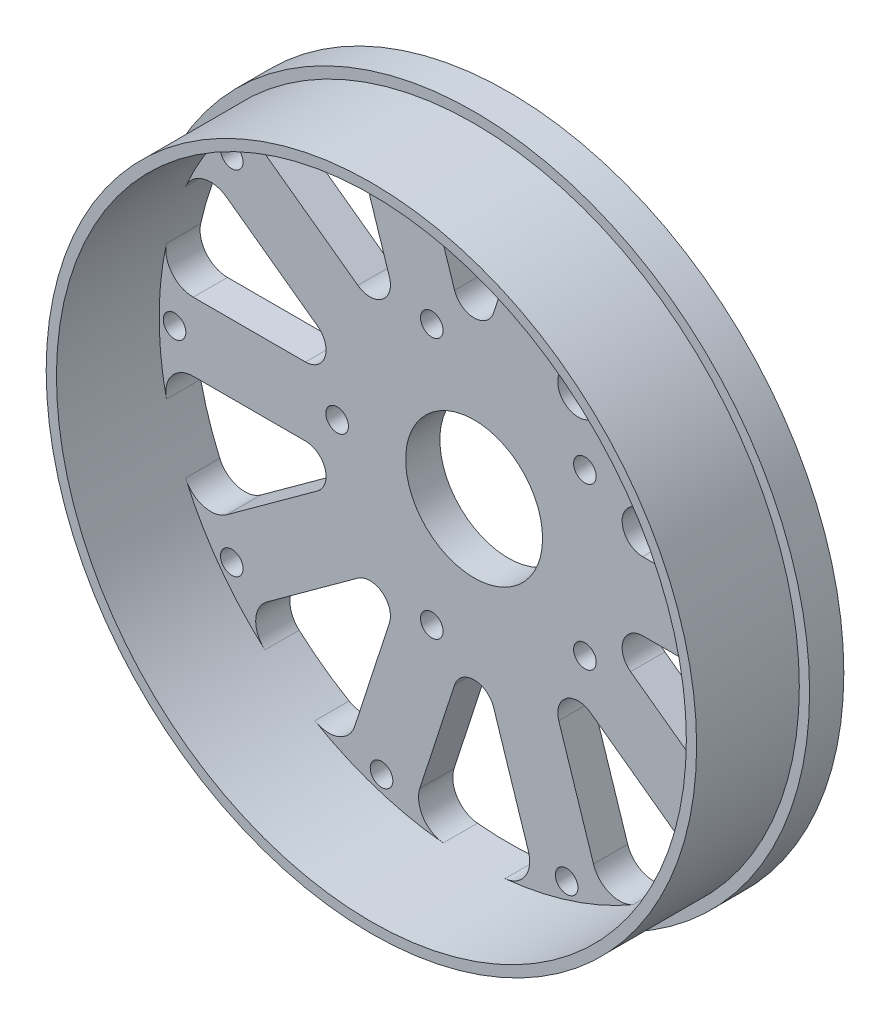
from build123d import *

# Parameters (mm, degrees)
BOSS_EXTRUDE3_DEPTH   = 15
BOSS_EXTRUDE4_START   = -5
SKETCH1_6_R           = 10
BOSS_EXTRUDE4_DEPTH   = 5
FILLET1_R             = 4
FILLET2_R             = 3
M4X0_7_TAPPED_HOLE1_D = 3.3
CIRPATTERN1_COUNT     = 5
M4X0_7_TAPPED_HOLE2_D = 3.3
CIRPATTERN2_COUNT     = 10


with BuildPart() as part:
    # Sketch1 → Boss-Extrude3 (new body)
    with BuildSketch(Plane.XY):
        with BuildLine():
            ThreePointArc((-45.727453461, 5), (-43.74859975, 14.214781741), (-39.933213221, 22.832837797))
            Line((-39.933213221, 22.832837797), (-41.153741247, 23.719603315))
            ThreePointArc((-41.153741247, 23.719603315), (-45.175184524, 14.678307233), (-47.236109069, 5))
            Line((-47.236109069, 5), (-45.727453461, 5))
        make_face()
        with BuildLine():
            ThreePointArc((-39.933213221, 22.832837797), (-37.214781741, 27.038121605), (-34.055360698, 30.923007741))
            Line((-34.055360698, 30.923007741), (-35.275888724, 31.809773258))
            ThreePointArc((-35.275888724, 31.809773258), (-38.428307233, 27.919799484), (-41.153741247, 23.719603315))
            Line((-41.153741247, 23.719603315), (-39.933213221, 22.832837797))
        make_face()
        with BuildLine():
            ThreePointArc((-34.055360698, 30.923007741), (-27.038121605, 37.214781741), (-18.88584281, 41.944307616))
            Line((-18.88584281, 41.944307616), (-19.352043032, 43.379124363))
            ThreePointArc((-19.352043032, 43.379124363), (-27.919799484, 38.428307233), (-35.275888724, 31.809773258))
            Line((-35.275888724, 31.809773258), (-34.055360698, 30.923007741))
        make_face()
        with BuildLine():
            ThreePointArc((-45.727453461, -5), (-46, 0), (-45.727453461, 5))
            Line((-45.727453461, 5), (-47.236109069, 5))
            ThreePointArc((-47.236109069, 5), (-47.5, 0), (-47.236109069, -5))
            Line((-47.236109069, -5), (-45.727453461, -5))
        make_face()
        with BuildLine():
            ThreePointArc((-39.933213221, -22.832837797), (-43.74859975, -14.214781741), (-45.727453461, -5))
            Line((-45.727453461, -5), (-47.236109069, -5))
            ThreePointArc((-47.236109069, -5), (-45.175184524, -14.678307233), (-41.153741247, -23.719603315))
            Line((-41.153741247, -23.719603315), (-39.933213221, -22.832837797))
        make_face()
        with BuildLine():
            Line((-35.275888724, -31.809773258), (-34.055360698, -30.923007741))
            ThreePointArc((-34.055360698, -30.923007741), (-37.214781741, -27.038121605), (-39.933213221, -22.832837797))
            Line((-39.933213221, -22.832837797), (-41.153741247, -23.719603315))
            ThreePointArc((-41.153741247, -23.719603315), (-38.428307233, -27.919799484), (-35.275888724, -31.809773258))
        make_face()
        with BuildLine():
            ThreePointArc((-18.88584281, 41.944307616), (-14.214781741, 43.74859975), (-9.375277647, 45.034477559))
            Line((-9.375277647, 45.034477559), (-9.841477869, 46.469294307))
            ThreePointArc((-9.841477869, 46.469294307), (-14.678307233, 45.175184524), (-19.352043032, 43.379124363))
            Line((-19.352043032, 43.379124363), (-18.88584281, 41.944307616))
        make_face()
        with BuildLine():
            ThreePointArc((-9.375277647, 45.034477559), (0, 46), (9.375277647, 45.034477559))
            Line((9.375277647, 45.034477559), (9.841477869, 46.469294307))
            ThreePointArc((9.841477869, 46.469294307), (0, 47.5), (-9.841477869, 46.469294307))
            Line((-9.841477869, 46.469294307), (-9.375277647, 45.034477559))
        make_face()
        with BuildLine():
            ThreePointArc((9.375277647, 45.034477559), (14.214781741, 43.74859975), (18.88584281, 41.944307616))
            Line((18.88584281, 41.944307616), (19.352043032, 43.379124363))
            ThreePointArc((19.352043032, 43.379124363), (14.678307233, 45.175184524), (9.841477869, 46.469294307))
            Line((9.841477869, 46.469294307), (9.375277647, 45.034477559))
        make_face()
        with BuildLine():
            ThreePointArc((18.88584281, 41.944307616), (27.038121605, 37.214781741), (34.055360698, 30.923007741))
            Line((34.055360698, 30.923007741), (35.275888724, 31.809773258))
            ThreePointArc((35.275888724, 31.809773258), (27.919799484, 38.428307233), (19.352043032, 43.379124363))
            Line((19.352043032, 43.379124363), (18.88584281, 41.944307616))
        make_face()
        with BuildLine():
            ThreePointArc((34.055360698, 30.923007741), (37.214781741, 27.038121605), (39.933213221, 22.832837797))
            Line((39.933213221, 22.832837797), (41.153741247, 23.719603315))
            ThreePointArc((41.153741247, 23.719603315), (38.428307233, 27.919799484), (35.275888724, 31.809773258))
            Line((35.275888724, 31.809773258), (34.055360698, 30.923007741))
        make_face()
        with BuildLine():
            ThreePointArc((39.933213221, 22.832837797), (43.74859975, 14.214781741), (45.727453461, 5))
            Line((45.727453461, 5), (47.236109069, 5))
            ThreePointArc((47.236109069, 5), (45.175184524, 14.678307233), (41.153741247, 23.719603315))
            Line((41.153741247, 23.719603315), (39.933213221, 22.832837797))
        make_face()
        with BuildLine():
            Line((47.236109069, 5), (45.727453461, 5))
            ThreePointArc((45.727453461, 5), (45.931812827, 2.503711326), (46, 0))
            ThreePointArc((46, 0), (45.931812827, -2.503711326), (45.727453461, -5))
            Line((45.727453461, -5), (47.236109069, -5))
            ThreePointArc((47.236109069, -5), (47.433981389, -2.5034795), (47.5, 0))
            ThreePointArc((47.5, 0), (47.433981389, 2.5034795), (47.236109069, 5))
        make_face()
        with BuildLine():
            Line((47.236109069, -5), (45.727453461, -5))
            ThreePointArc((45.727453461, -5), (43.74859975, -14.214781741), (39.933213221, -22.832837797))
            Line((39.933213221, -22.832837797), (41.153741247, -23.719603315))
            ThreePointArc((41.153741247, -23.719603315), (45.175184524, -14.678307233), (47.236109069, -5))
        make_face()
        with BuildLine():
            Line((41.153741247, -23.719603315), (39.933213221, -22.832837797))
            ThreePointArc((39.933213221, -22.832837797), (37.214781741, -27.038121605), (34.055360698, -30.923007741))
            Line((34.055360698, -30.923007741), (35.275888724, -31.809773258))
            ThreePointArc((35.275888724, -31.809773258), (38.428307233, -27.919799484), (41.153741247, -23.719603315))
        make_face()
        with BuildLine():
            Line((35.275888724, -31.809773258), (34.055360698, -30.923007741))
            ThreePointArc((34.055360698, -30.923007741), (27.038121605, -37.214781741), (18.88584281, -41.944307616))
            Line((18.88584281, -41.944307616), (19.352043032, -43.379124363))
            ThreePointArc((19.352043032, -43.379124363), (27.919799484, -38.428307233), (35.275888724, -31.809773258))
        make_face()
        with BuildLine():
            Line((19.352043032, -43.379124363), (18.88584281, -41.944307616))
            ThreePointArc((18.88584281, -41.944307616), (14.214781741, -43.74859975), (9.375277647, -45.034477559))
            Line((9.375277647, -45.034477559), (9.841477869, -46.469294307))
            ThreePointArc((9.841477869, -46.469294307), (14.678307233, -45.175184524), (19.352043032, -43.379124363))
        make_face()
        with BuildLine():
            Line((9.841477869, -46.469294307), (9.375277647, -45.034477559))
            ThreePointArc((9.375277647, -45.034477559), (0, -46), (-9.375277647, -45.034477559))
            Line((-9.375277647, -45.034477559), (-9.841477869, -46.469294307))
            ThreePointArc((-9.841477869, -46.469294307), (0, -47.5), (9.841477869, -46.469294307))
        make_face()
        with BuildLine():
            Line((-9.841477869, -46.469294307), (-9.375277647, -45.034477559))
            ThreePointArc((-9.375277647, -45.034477559), (-14.214781741, -43.74859975), (-18.88584281, -41.944307616))
            Line((-18.88584281, -41.944307616), (-19.352043032, -43.379124363))
            ThreePointArc((-19.352043032, -43.379124363), (-14.678307233, -45.175184524), (-9.841477869, -46.469294307))
        make_face()
        with BuildLine():
            Line((-19.352043032, -43.379124363), (-18.88584281, -41.944307616))
            ThreePointArc((-18.88584281, -41.944307616), (-27.038121605, -37.214781741), (-34.055360698, -30.923007741))
            Line((-34.055360698, -30.923007741), (-35.275888724, -31.809773258))
            ThreePointArc((-35.275888724, -31.809773258), (-27.919799484, -38.428307233), (-19.352043032, -43.379124363))
        make_face()
    extrude(amount=BOSS_EXTRUDE3_DEPTH)

    # Sketch1<6> → Boss-Extrude4 (add)
    # profile 1 of 41: a face of its own
    with BuildSketch(Plane.XY.offset(BOSS_EXTRUDE4_START)):
        with BuildLine():
            ThreePointArc((-19.352043032, 43.379124363), (-14.678307233, 45.175184524), (-9.841477869, 46.469294307))
            Line((-9.841477869, 46.469294307), (-10.307512998, 47.903602952))
            ThreePointArc((-10.307512998, 47.903602952), (-15.141832724, 46.601769298), (-19.818078161, 44.813433008))
            Line((-19.818078161, 44.813433008), (-19.352043032, 43.379124363))
        make_face()
    # profile 2 of 41: a face of its own
    with BuildSketch(Plane.XY.offset(BOSS_EXTRUDE4_START)):
        with BuildLine():
            ThreePointArc((-9.841477869, 46.469294307), (0, 47.5), (9.841477869, 46.469294307))
            Line((9.841477869, 46.469294307), (10.307512998, 47.903602952))
            ThreePointArc((10.307512998, 47.903602952), (0, 49), (-10.307512998, 47.903602952))
            Line((-10.307512998, 47.903602952), (-9.841477869, 46.469294307))
        make_face()
    # profile 3 of 41: a face of its own
    with BuildSketch(Plane.XY.offset(BOSS_EXTRUDE4_START)):
        with BuildLine():
            ThreePointArc((9.841477869, 46.469294307), (14.678307233, 45.175184524), (19.352043032, 43.379124363))
            Line((19.352043032, 43.379124363), (19.818078161, 44.813433008))
            ThreePointArc((19.818078161, 44.813433008), (15.141832724, 46.601769298), (10.307512998, 47.903602952))
            Line((10.307512998, 47.903602952), (9.841477869, 46.469294307))
        make_face()
    # profile 4 of 41: a face of its own
    with BuildSketch(Plane.XY.offset(BOSS_EXTRUDE4_START)):
        with BuildLine():
            ThreePointArc((19.352043032, 43.379124363), (27.919799484, 38.428307233), (35.275888724, 31.809773258))
            Line((35.275888724, 31.809773258), (36.495984532, 32.696224752))
            ThreePointArc((36.495984532, 32.696224752), (28.801477362, 39.641832724), (19.818078161, 44.813433008))
            Line((19.818078161, 44.813433008), (19.352043032, 43.379124363))
        make_face()
    # profile 5 of 41: a face of its own
    with BuildSketch(Plane.XY.offset(BOSS_EXTRUDE4_START)):
        with BuildLine():
            ThreePointArc((35.275888724, 31.809773258), (38.428307233, 27.919799484), (41.153741247, 23.719603315))
            Line((41.153741247, 23.719603315), (42.373837055, 24.606054808))
            ThreePointArc((42.373837055, 24.606054808), (39.641832724, 28.801477362), (36.495984532, 32.696224752))
            Line((36.495984532, 32.696224752), (35.275888724, 31.809773258))
        make_face()
    # profile 6 of 41: a face of its own
    with BuildSketch(Plane.XY.offset(BOSS_EXTRUDE4_START)):
        with BuildLine():
            ThreePointArc((41.153741247, 23.719603315), (45.175184524, 14.678307233), (47.236109069, 5))
            Line((47.236109069, 5), (48.744230428, 5))
            ThreePointArc((48.744230428, 5), (46.601769298, 15.141832724), (42.373837055, 24.606054808))
            Line((42.373837055, 24.606054808), (41.153741247, 23.719603315))
        make_face()
    # profile 7 of 41: a face of its own
    with BuildSketch(Plane.XY.offset(BOSS_EXTRUDE4_START)):
        with BuildLine():
            Line((48.744230428, 5), (47.236109069, 5))
            ThreePointArc((47.236109069, 5), (47.433981389, 2.5034795), (47.5, 0))
            ThreePointArc((47.5, 0), (47.433981389, -2.5034795), (47.236109069, -5))
            Line((47.236109069, -5), (48.744230428, -5))
            ThreePointArc((48.744230428, -5), (48.936015832, -2.503268767), (49, 0))
            ThreePointArc((49, 0), (48.936015832, 2.503268767), (48.744230428, 5))
        make_face()
    # profile 8 of 41: a face of its own
    with BuildSketch(Plane.XY.offset(BOSS_EXTRUDE4_START)):
        with BuildLine():
            Line((48.744230428, -5), (47.236109069, -5))
            ThreePointArc((47.236109069, -5), (45.175184524, -14.678307233), (41.153741247, -23.719603315))
            Line((41.153741247, -23.719603315), (42.373837055, -24.606054808))
            ThreePointArc((42.373837055, -24.606054808), (46.601769298, -15.141832724), (48.744230428, -5))
        make_face()
    # profile 9 of 41: a face of its own
    with BuildSketch(Plane.XY.offset(BOSS_EXTRUDE4_START)):
        with BuildLine():
            Line((42.373837055, -24.606054808), (41.153741247, -23.719603315))
            ThreePointArc((41.153741247, -23.719603315), (38.428307233, -27.919799484), (35.275888724, -31.809773258))
            Line((35.275888724, -31.809773258), (36.495984532, -32.696224752))
            ThreePointArc((36.495984532, -32.696224752), (39.641832724, -28.801477362), (42.373837055, -24.606054808))
        make_face()
    # profile 10 of 41: a face of its own
    with BuildSketch(Plane.XY.offset(BOSS_EXTRUDE4_START)):
        with BuildLine():
            Line((36.495984532, -32.696224752), (35.275888724, -31.809773258))
            ThreePointArc((35.275888724, -31.809773258), (27.919799484, -38.428307233), (19.352043032, -43.379124363))
            Line((19.352043032, -43.379124363), (19.818078161, -44.813433008))
            ThreePointArc((19.818078161, -44.813433008), (28.801477362, -39.641832724), (36.495984532, -32.696224752))
        make_face()
    # profile 11 of 41: a face of its own
    with BuildSketch(Plane.XY.offset(BOSS_EXTRUDE4_START)):
        with BuildLine():
            Line((19.818078161, -44.813433008), (19.352043032, -43.379124363))
            ThreePointArc((19.352043032, -43.379124363), (14.678307233, -45.175184524), (9.841477869, -46.469294307))
            Line((9.841477869, -46.469294307), (10.307512998, -47.903602952))
            ThreePointArc((10.307512998, -47.903602952), (15.141832724, -46.601769298), (19.818078161, -44.813433008))
        make_face()
    # profile 12 of 41: a face of its own
    with BuildSketch(Plane.XY.offset(BOSS_EXTRUDE4_START)):
        with BuildLine():
            Line((10.307512998, -47.903602952), (9.841477869, -46.469294307))
            ThreePointArc((9.841477869, -46.469294307), (0, -47.5), (-9.841477869, -46.469294307))
            Line((-9.841477869, -46.469294307), (-10.307512998, -47.903602952))
            ThreePointArc((-10.307512998, -47.903602952), (0, -49), (10.307512998, -47.903602952))
        make_face()
    # profile 13 of 41: a face of its own
    with BuildSketch(Plane.XY.offset(BOSS_EXTRUDE4_START)):
        with BuildLine():
            Line((-10.307512998, -47.903602952), (-9.841477869, -46.469294307))
            ThreePointArc((-9.841477869, -46.469294307), (-14.678307233, -45.175184524), (-19.352043032, -43.379124363))
            Line((-19.352043032, -43.379124363), (-19.818078161, -44.813433008))
            ThreePointArc((-19.818078161, -44.813433008), (-15.141832724, -46.601769298), (-10.307512998, -47.903602952))
        make_face()
    # profile 14 of 41: a face of its own
    with BuildSketch(Plane.XY.offset(BOSS_EXTRUDE4_START)):
        with BuildLine():
            Line((-19.818078161, -44.813433008), (-19.352043032, -43.379124363))
            ThreePointArc((-19.352043032, -43.379124363), (-27.919799484, -38.428307233), (-35.275888724, -31.809773258))
            Line((-35.275888724, -31.809773258), (-36.495984532, -32.696224752))
            ThreePointArc((-36.495984532, -32.696224752), (-28.801477362, -39.641832724), (-19.818078161, -44.813433008))
        make_face()
    # profile 15 of 41: a face of its own
    with BuildSketch(Plane.XY.offset(BOSS_EXTRUDE4_START)):
        with BuildLine():
            Line((-36.495984532, -32.696224752), (-35.275888724, -31.809773258))
            ThreePointArc((-35.275888724, -31.809773258), (-38.428307233, -27.919799484), (-41.153741247, -23.719603315))
            Line((-41.153741247, -23.719603315), (-42.373837055, -24.606054808))
            ThreePointArc((-42.373837055, -24.606054808), (-39.641832724, -28.801477362), (-36.495984532, -32.696224752))
        make_face()
    # profile 16 of 41: a face of its own
    with BuildSketch(Plane.XY.offset(BOSS_EXTRUDE4_START)):
        with BuildLine():
            ThreePointArc((-41.153741247, -23.719603315), (-45.175184524, -14.678307233), (-47.236109069, -5))
            Line((-47.236109069, -5), (-48.744230428, -5))
            ThreePointArc((-48.744230428, -5), (-46.601769298, -15.141832724), (-42.373837055, -24.606054808))
            Line((-42.373837055, -24.606054808), (-41.153741247, -23.719603315))
        make_face()
    # profile 17 of 41: a face of its own
    with BuildSketch(Plane.XY.offset(BOSS_EXTRUDE4_START)):
        with BuildLine():
            ThreePointArc((-47.236109069, -5), (-47.5, 0), (-47.236109069, 5))
            Line((-47.236109069, 5), (-48.744230428, 5))
            ThreePointArc((-48.744230428, 5), (-49, 0), (-48.744230428, -5))
            Line((-48.744230428, -5), (-47.236109069, -5))
        make_face()
    # profile 18 of 41: a face of its own
    with BuildSketch(Plane.XY.offset(BOSS_EXTRUDE4_START)):
        with BuildLine():
            ThreePointArc((-47.236109069, 5), (-45.175184524, 14.678307233), (-41.153741247, 23.719603315))
            Line((-41.153741247, 23.719603315), (-42.373837055, 24.606054808))
            ThreePointArc((-42.373837055, 24.606054808), (-46.601769298, 15.141832724), (-48.744230428, 5))
            Line((-48.744230428, 5), (-47.236109069, 5))
        make_face()
    # profile 19 of 41: a face of its own
    with BuildSketch(Plane.XY.offset(BOSS_EXTRUDE4_START)):
        with BuildLine():
            ThreePointArc((-41.153741247, 23.719603315), (-38.428307233, 27.919799484), (-35.275888724, 31.809773258))
            Line((-35.275888724, 31.809773258), (-36.495984532, 32.696224752))
            ThreePointArc((-36.495984532, 32.696224752), (-39.641832724, 28.801477362), (-42.373837055, 24.606054808))
            Line((-42.373837055, 24.606054808), (-41.153741247, 23.719603315))
        make_face()
    # profile 20 of 41: a face of its own
    with BuildSketch(Plane.XY.offset(BOSS_EXTRUDE4_START)):
        with BuildLine():
            ThreePointArc((-35.275888724, 31.809773258), (-27.919799484, 38.428307233), (-19.352043032, 43.379124363))
            Line((-19.352043032, 43.379124363), (-19.818078161, 44.813433008))
            ThreePointArc((-19.818078161, 44.813433008), (-28.801477362, 39.641832724), (-36.495984532, 32.696224752))
            Line((-36.495984532, 32.696224752), (-35.275888724, 31.809773258))
        make_face()
    # profile 21 of 41: a face of its own
    with BuildSketch(Plane.XY.offset(BOSS_EXTRUDE4_START)):
        with BuildLine():
            ThreePointArc((9.375277647, 45.034477559), (14.214781741, 43.74859975), (18.88584281, 41.944307616))
            Line((18.88584281, 41.944307616), (19.352043032, 43.379124363))
            ThreePointArc((19.352043032, 43.379124363), (14.678307233, 45.175184524), (9.841477869, 46.469294307))
            Line((9.841477869, 46.469294307), (9.375277647, 45.034477559))
        make_face()
    # profile 22 of 41: a face of its own
    with BuildSketch(Plane.XY.offset(BOSS_EXTRUDE4_START)):
        with BuildLine():
            ThreePointArc((18.88584281, 41.944307616), (27.038121605, 37.214781741), (34.055360698, 30.923007741))
            Line((34.055360698, 30.923007741), (35.275888724, 31.809773258))
            ThreePointArc((35.275888724, 31.809773258), (27.919799484, 38.428307233), (19.352043032, 43.379124363))
            Line((19.352043032, 43.379124363), (18.88584281, 41.944307616))
        make_face()
    # profile 23 of 41: a face of its own
    with BuildSketch(Plane.XY.offset(BOSS_EXTRUDE4_START)):
        with BuildLine():
            ThreePointArc((34.055360698, 30.923007741), (37.214781741, 27.038121605), (39.933213221, 22.832837797))
            Line((39.933213221, 22.832837797), (41.153741247, 23.719603315))
            ThreePointArc((41.153741247, 23.719603315), (38.428307233, 27.919799484), (35.275888724, 31.809773258))
            Line((35.275888724, 31.809773258), (34.055360698, 30.923007741))
        make_face()
    # profile 24 of 41: a face of its own
    with BuildSketch(Plane.XY.offset(BOSS_EXTRUDE4_START)):
        with BuildLine():
            ThreePointArc((39.933213221, 22.832837797), (43.74859975, 14.214781741), (45.727453461, 5))
            Line((45.727453461, 5), (47.236109069, 5))
            ThreePointArc((47.236109069, 5), (45.175184524, 14.678307233), (41.153741247, 23.719603315))
            Line((41.153741247, 23.719603315), (39.933213221, 22.832837797))
        make_face()
    # profile 25 of 41: a face of its own
    with BuildSketch(Plane.XY.offset(BOSS_EXTRUDE4_START)):
        with BuildLine():
            Line((47.236109069, 5), (45.727453461, 5))
            ThreePointArc((45.727453461, 5), (45.931812827, 2.503711326), (46, 0))
            ThreePointArc((46, 0), (45.931812827, -2.503711326), (45.727453461, -5))
            Line((45.727453461, -5), (47.236109069, -5))
            ThreePointArc((47.236109069, -5), (47.433981389, -2.5034795), (47.5, 0))
            ThreePointArc((47.5, 0), (47.433981389, 2.5034795), (47.236109069, 5))
        make_face()
    # profile 26 of 41: a face of its own
    with BuildSketch(Plane.XY.offset(BOSS_EXTRUDE4_START)):
        with BuildLine():
            Line((47.236109069, -5), (45.727453461, -5))
            ThreePointArc((45.727453461, -5), (43.74859975, -14.214781741), (39.933213221, -22.832837797))
            Line((39.933213221, -22.832837797), (41.153741247, -23.719603315))
            ThreePointArc((41.153741247, -23.719603315), (45.175184524, -14.678307233), (47.236109069, -5))
        make_face()
    # profile 27 of 41: a face of its own
    with BuildSketch(Plane.XY.offset(BOSS_EXTRUDE4_START)):
        with BuildLine():
            Line((41.153741247, -23.719603315), (39.933213221, -22.832837797))
            ThreePointArc((39.933213221, -22.832837797), (37.214781741, -27.038121605), (34.055360698, -30.923007741))
            Line((34.055360698, -30.923007741), (35.275888724, -31.809773258))
            ThreePointArc((35.275888724, -31.809773258), (38.428307233, -27.919799484), (41.153741247, -23.719603315))
        make_face()
    # profile 28 of 41: a face of its own
    with BuildSketch(Plane.XY.offset(BOSS_EXTRUDE4_START)):
        with BuildLine():
            Line((35.275888724, -31.809773258), (34.055360698, -30.923007741))
            ThreePointArc((34.055360698, -30.923007741), (27.038121605, -37.214781741), (18.88584281, -41.944307616))
            Line((18.88584281, -41.944307616), (19.352043032, -43.379124363))
            ThreePointArc((19.352043032, -43.379124363), (27.919799484, -38.428307233), (35.275888724, -31.809773258))
        make_face()
    # profile 29 of 41: a face of its own
    with BuildSketch(Plane.XY.offset(BOSS_EXTRUDE4_START)):
        with BuildLine():
            Line((19.352043032, -43.379124363), (18.88584281, -41.944307616))
            ThreePointArc((18.88584281, -41.944307616), (14.214781741, -43.74859975), (9.375277647, -45.034477559))
            Line((9.375277647, -45.034477559), (9.841477869, -46.469294307))
            ThreePointArc((9.841477869, -46.469294307), (14.678307233, -45.175184524), (19.352043032, -43.379124363))
        make_face()
    # profile 30 of 41: a face of its own
    with BuildSketch(Plane.XY.offset(BOSS_EXTRUDE4_START)):
        with BuildLine():
            Line((9.841477869, -46.469294307), (9.375277647, -45.034477559))
            ThreePointArc((9.375277647, -45.034477559), (0, -46), (-9.375277647, -45.034477559))
            Line((-9.375277647, -45.034477559), (-9.841477869, -46.469294307))
            ThreePointArc((-9.841477869, -46.469294307), (0, -47.5), (9.841477869, -46.469294307))
        make_face()
    # profile 31 of 41: a face of its own
    with BuildSketch(Plane.XY.offset(BOSS_EXTRUDE4_START)):
        with BuildLine():
            Line((-9.841477869, -46.469294307), (-9.375277647, -45.034477559))
            ThreePointArc((-9.375277647, -45.034477559), (-14.214781741, -43.74859975), (-18.88584281, -41.944307616))
            Line((-18.88584281, -41.944307616), (-19.352043032, -43.379124363))
            ThreePointArc((-19.352043032, -43.379124363), (-14.678307233, -45.175184524), (-9.841477869, -46.469294307))
        make_face()
    # profile 32 of 41: a face of its own
    with BuildSketch(Plane.XY.offset(BOSS_EXTRUDE4_START)):
        with BuildLine():
            Line((-19.352043032, -43.379124363), (-18.88584281, -41.944307616))
            ThreePointArc((-18.88584281, -41.944307616), (-27.038121605, -37.214781741), (-34.055360698, -30.923007741))
            Line((-34.055360698, -30.923007741), (-35.275888724, -31.809773258))
            ThreePointArc((-35.275888724, -31.809773258), (-27.919799484, -38.428307233), (-19.352043032, -43.379124363))
        make_face()
    # profile 33 of 41: a face of its own
    with BuildSketch(Plane.XY.offset(BOSS_EXTRUDE4_START)):
        with BuildLine():
            Line((-35.275888724, -31.809773258), (-34.055360698, -30.923007741))
            ThreePointArc((-34.055360698, -30.923007741), (-37.214781741, -27.038121605), (-39.933213221, -22.832837797))
            Line((-39.933213221, -22.832837797), (-41.153741247, -23.719603315))
            ThreePointArc((-41.153741247, -23.719603315), (-38.428307233, -27.919799484), (-35.275888724, -31.809773258))
        make_face()
    # profile 34 of 41: a face of its own
    with BuildSketch(Plane.XY.offset(BOSS_EXTRUDE4_START)):
        with BuildLine():
            ThreePointArc((-39.933213221, -22.832837797), (-43.74859975, -14.214781741), (-45.727453461, -5))
            Line((-45.727453461, -5), (-47.236109069, -5))
            ThreePointArc((-47.236109069, -5), (-45.175184524, -14.678307233), (-41.153741247, -23.719603315))
            Line((-41.153741247, -23.719603315), (-39.933213221, -22.832837797))
        make_face()
    # profile 35 of 41: a face of its own
    with BuildSketch(Plane.XY.offset(BOSS_EXTRUDE4_START)):
        with BuildLine():
            ThreePointArc((-45.727453461, -5), (-46, 0), (-45.727453461, 5))
            Line((-45.727453461, 5), (-47.236109069, 5))
            ThreePointArc((-47.236109069, 5), (-47.5, 0), (-47.236109069, -5))
            Line((-47.236109069, -5), (-45.727453461, -5))
        make_face()
    # profile 36 of 41: a face of its own
    with BuildSketch(Plane.XY.offset(BOSS_EXTRUDE4_START)):
        with BuildLine():
            ThreePointArc((-45.727453461, 5), (-43.74859975, 14.214781741), (-39.933213221, 22.832837797))
            Line((-39.933213221, 22.832837797), (-41.153741247, 23.719603315))
            ThreePointArc((-41.153741247, 23.719603315), (-45.175184524, 14.678307233), (-47.236109069, 5))
            Line((-47.236109069, 5), (-45.727453461, 5))
        make_face()
    # profile 37 of 41: a face of its own
    with BuildSketch(Plane.XY.offset(BOSS_EXTRUDE4_START)):
        with BuildLine():
            ThreePointArc((-39.933213221, 22.832837797), (-37.214781741, 27.038121605), (-34.055360698, 30.923007741))
            Line((-34.055360698, 30.923007741), (-35.275888724, 31.809773258))
            ThreePointArc((-35.275888724, 31.809773258), (-38.428307233, 27.919799484), (-41.153741247, 23.719603315))
            Line((-41.153741247, 23.719603315), (-39.933213221, 22.832837797))
        make_face()
    # profile 38 of 41: a face of its own
    with BuildSketch(Plane.XY.offset(BOSS_EXTRUDE4_START)):
        with BuildLine():
            ThreePointArc((-34.055360698, 30.923007741), (-27.038121605, 37.214781741), (-18.88584281, 41.944307616))
            Line((-18.88584281, 41.944307616), (-19.352043032, 43.379124363))
            ThreePointArc((-19.352043032, 43.379124363), (-27.919799484, 38.428307233), (-35.275888724, 31.809773258))
            Line((-35.275888724, 31.809773258), (-34.055360698, 30.923007741))
        make_face()
    # profile 39 of 41: a face of its own
    with BuildSketch(Plane.XY.offset(BOSS_EXTRUDE4_START)):
        with BuildLine():
            ThreePointArc((-18.88584281, 41.944307616), (-14.214781741, 43.74859975), (-9.375277647, 45.034477559))
            Line((-9.375277647, 45.034477559), (-9.841477869, 46.469294307))
            ThreePointArc((-9.841477869, 46.469294307), (-14.678307233, 45.175184524), (-19.352043032, 43.379124363))
            Line((-19.352043032, 43.379124363), (-18.88584281, 41.944307616))
        make_face()
    # profile 40 of 41: a face of its own
    with BuildSketch(Plane.XY.offset(BOSS_EXTRUDE4_START)):
        with BuildLine():
            ThreePointArc((-9.375277647, 45.034477559), (0, 46), (9.375277647, 45.034477559))
            Line((9.375277647, 45.034477559), (9.841477869, 46.469294307))
            ThreePointArc((9.841477869, 46.469294307), (0, 47.5), (-9.841477869, 46.469294307))
            Line((-9.841477869, 46.469294307), (-9.375277647, 45.034477559))
        make_face()
    # profile 41 of 41: a face of its own
    with BuildSketch(Plane.XY.offset(BOSS_EXTRUDE4_START)):
        with BuildLine():
            Line((45.727453461, 5), (15.388417686, 5))
            Line((15.388417686, 5), (39.933213221, 22.832837797))
            ThreePointArc((39.933213221, 22.832837797), (37.214781741, 27.038121605), (34.055360698, 30.923007741))
            Line((34.055360698, 30.923007741), (9.510565163, 13.090169944))
            Line((9.510565163, 13.090169944), (18.88584281, 41.944307616))
            ThreePointArc((18.88584281, 41.944307616), (14.214781741, 43.74859975), (9.375277647, 45.034477559))
            Line((9.375277647, 45.034477559), (0, 16.180339887))
            Line((0, 16.180339887), (-9.375277647, 45.034477559))
            ThreePointArc((-9.375277647, 45.034477559), (-14.214781741, 43.74859975), (-18.88584281, 41.944307616))
            Line((-18.88584281, 41.944307616), (-9.510565163, 13.090169944))
            Line((-9.510565163, 13.090169944), (-34.055360698, 30.923007741))
            ThreePointArc((-34.055360698, 30.923007741), (-37.214781741, 27.038121605), (-39.933213221, 22.832837797))
            Line((-39.933213221, 22.832837797), (-15.388417686, 5))
            Line((-15.388417686, 5), (-45.727453461, 5))
            ThreePointArc((-45.727453461, 5), (-46, 0), (-45.727453461, -5))
            Line((-45.727453461, -5), (-15.388417686, -5))
            Line((-15.388417686, -5), (-39.933213221, -22.832837797))
            ThreePointArc((-39.933213221, -22.832837797), (-37.214781741, -27.038121605), (-34.055360698, -30.923007741))
            Line((-34.055360698, -30.923007741), (-9.510565163, -13.090169944))
            Line((-9.510565163, -13.090169944), (-18.88584281, -41.944307616))
            ThreePointArc((-18.88584281, -41.944307616), (-14.214781741, -43.74859975), (-9.375277647, -45.034477559))
            Line((-9.375277647, -45.034477559), (0, -16.180339887))
            Line((0, -16.180339887), (9.375277647, -45.034477559))
            ThreePointArc((9.375277647, -45.034477559), (14.214781741, -43.74859975), (18.88584281, -41.944307616))
            Line((18.88584281, -41.944307616), (9.510565163, -13.090169944))
            Line((9.510565163, -13.090169944), (34.055360698, -30.923007741))
            ThreePointArc((34.055360698, -30.923007741), (37.214781741, -27.038121605), (39.933213221, -22.832837797))
            Line((39.933213221, -22.832837797), (15.388417686, -5))
            Line((15.388417686, -5), (45.727453461, -5))
            ThreePointArc((45.727453461, -5), (45.931812827, -2.503711326), (46, 0))
            ThreePointArc((46, 0), (45.931812827, 2.503711326), (45.727453461, 5))
        make_face()
        Circle(SKETCH1_6_R, mode=Mode.SUBTRACT)
    extrude(amount=BOSS_EXTRUDE4_DEPTH)

    # Fillet1
    # the kernel refuses this fillet: 4 mm, written as the material it adds along each edge
    with BuildSketch(Plane(origin=(-34.055360698, 30.923007741, -5), x_dir=(0.7108839082024422, 0.7033093693808024, 0), z_dir=(0, 0, 1)), Plane(origin=(-9.375277647, 45.034477559, -5), x_dir=(0.9885120378846195, 0.15114215479870854, 0), z_dir=(0, 0, 1)), Plane(origin=(45.727453461, -5, -5), x_dir=(-0.16172228764240998, -0.9868363094656103, 0), z_dir=(0, 0, 1)), Plane(origin=(34.055360698, -30.923007741, -5), x_dir=(-0.7108839082025105, -0.7033093693807332, 0), z_dir=(0, 0, 1)), Plane(origin=(9.375277647, -45.034477559, -5), x_dir=(-0.9885120378846224, -0.15114215479868973, 0), z_dir=(0, 0, 1)), Plane(origin=(-18.88584281, -41.944307616, -5), x_dir=(-0.8885621673832776, 0.4587562257835115, 0), z_dir=(0, 0, 1)), Plane(origin=(-39.933213221, -22.832837797, -5), x_dir=(-0.4492117500588274, 0.893425320667086, 0), z_dir=(0, 0, 1)), Plane(origin=(-45.727453461, 5, -5), x_dir=(0.16172228764235855, 0.9868363094656187, 0), z_dir=(0, 0, 1)), Plane(origin=(18.88584281, 41.944307616, -5), x_dir=(0.8885621673832427, -0.45875622578357905, 0), z_dir=(0, 0, 1)), Plane(origin=(39.933213221, 22.832837797, -5), x_dir=(0.4492117500587163, -0.893425320667142, 0), z_dir=(0, 0, 1))) as fillet1_piece_1:
        with BuildLine():
            CenterArc((4.707936553, -3.994271552), FILLET1_R, 86.933252991, 102.373625116)
            Line((0.760591315, -4.641160703), (0, 0))
            ThreePointArc((0, 0), (2.460966834, 0.065877147), (4.921933669, 0))
        make_face()
    extrude(amount=5)
    with BuildSketch(Plane(origin=(9.375277647, 45.034477559, -5), x_dir=(-0.9885120378846203, 0.1511421547987031, 0), z_dir=(0, 0, 1)), Plane(origin=(39.933213221, -22.832837797, -5), x_dir=(0.44921175005871306, 0.8934253206671435, 0), z_dir=(0, 0, 1)), Plane(origin=(34.055360698, 30.923007741, -5), x_dir=(-0.7108839082024975, 0.7033093693807462, 0), z_dir=(0, 0, 1)), Plane(origin=(-18.88584281, 41.944307616, -5), x_dir=(-0.8885621673832371, -0.45875622578358993, 0), z_dir=(0, 0, 1)), Plane(origin=(18.88584281, -41.944307616, -5), x_dir=(0.8885621673832121, 0.4587562257836381, 0), z_dir=(0, 0, 1)), Plane(origin=(-9.375277647, -45.034477559, -5), x_dir=(0.988512037884622, -0.15114215479869167, 0), z_dir=(0, 0, 1)), Plane(origin=(-34.055360698, -30.923007741, -5), x_dir=(0.7108839082025497, -0.7033093693806937, 0), z_dir=(0, 0, 1)), Plane(origin=(-45.727453461, -5, -5), x_dir=(0.16172228764234597, -0.9868363094656206, 0), z_dir=(0, 0, 1)), Plane(origin=(-39.933213221, 22.832837797, -5), x_dir=(-0.44921175005870206, -0.8934253206671492, 0), z_dir=(0, 0, 1)), Plane(origin=(45.727453461, 5, -5), x_dir=(-0.16172228764240423, 0.9868363094656112, 0), z_dir=(0, 0, 1))) as fillet1_piece_2:
        with BuildLine():
            CenterArc((4.707936553, 3.994271552), FILLET1_R, 170.693121893, 102.373625116)
            Line((0.760591315, 4.641160703), (0, 0))
            ThreePointArc((0, 0), (2.460966834, -0.065877147), (4.921933669, 0))
        make_face()
    extrude(amount=5)

    # Fillet2
    fillet2_edges = [part.edges().sort_by_distance(p)[0] for p in [
        (-9.510565163, 13.090169944, -2.5),
        (9.510565163, -13.090169944, -2.5),
        (0, -16.180339887, -2.5),
        (-9.510565163, -13.090169944, -2.5),
        (-15.388417686, -5, -2.5),
        (-15.388417686, 5, -2.5),
        (15.388417686, 5, -2.5),
        (0, 16.180339887, -2.5),
        (15.388417686, -5, -2.5),
        (9.510565163, 13.090169944, -2.5),
    ]]
    fillet(fillet2_edges, radius=FILLET2_R)

    # M4x0.7 Tapped Hole1 (through all)
    with Locations(Plane(origin=(0, 0, -5), x_dir=(-1, 0, 0), z_dir=(0, 0, -1))):
        with Locations((20, 0)):
            m4x0_7_tapped_hole1 = Hole(M4X0_7_TAPPED_HOLE1_D / 2)

    # CirPattern1: M4x0.7 Tapped Hole1 ×5 about axis
    cirpattern1_axis = Axis((0, 0, 0), (0, 0, 1))
    for i in range(1, CIRPATTERN1_COUNT):
        add(m4x0_7_tapped_hole1.rotate(cirpattern1_axis, i * 360 / CIRPATTERN1_COUNT), mode=Mode.SUBTRACT)

    # M4x0.7 Tapped Hole2 (through all)
    with Locations(Plane(origin=(0, 0, -5), x_dir=(-1, 0, 0), z_dir=(0, 0, -1))):
        with Locations((43.75, 0)):
            m4x0_7_tapped_hole2 = Hole(M4X0_7_TAPPED_HOLE2_D / 2)

    # CirPattern2: M4x0.7 Tapped Hole2 ×10 about axis
    cirpattern2_axis = Axis((0, 0, 0), (0, 0, 1))
    for i in range(1, CIRPATTERN2_COUNT):
        add(m4x0_7_tapped_hole2.rotate(cirpattern2_axis, i * 360 / CIRPATTERN2_COUNT), mode=Mode.SUBTRACT)


solid = part.part
